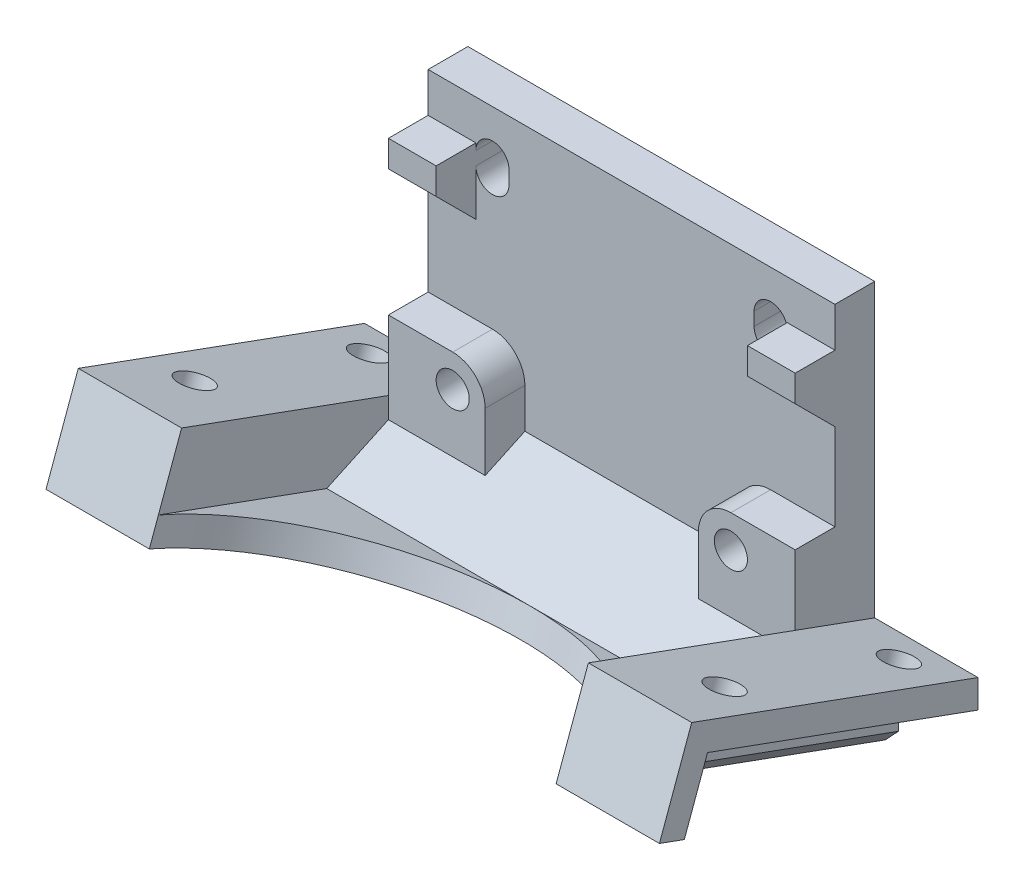
from build123d import *

# Parameters (mm, degrees)
BOSS_EXTRUDE1_DEPTH             = 3
BOSS_EXTRUDE2_REACH             = 67.424
BOSS_EXTRUDE2_DIRECTION_2_REACH = 67.424
BOSS_EXTRUDE3_DEPTH             = 1.8
BOSS_EXTRUDE4_DEPTH             = 6
SKETCH5_R                       = 1.2500000000000013
CUT_EXTRUDE1_DEPTH              = 52.534261642227
BOSS_EXTRUDE5_START             = -17.153882977
BOSS_EXTRUDE5_DEPTH             = 34.307765954
BOSS_EXTRUDE5_START_2           = -23.153882977
BOSS_EXTRUDE5_2_DEPTH           = 46.307765954
SKETCH7_R                       = 1.2499999999999996
CUT_EXTRUDE2_DEPTH              = 72.76321538065721
SKETCH8_R                       = 1.2499999999999996
SKETCH8_W                       = 3.603882977174097
SKETCH8_H                       = 2
BOSS_EXTRUDE6_DEPTH             = 3
CHAMFER1_SIZE                   = 3
CHAMFER3_SIZE                   = 1
CUT_EXTRUDE3_DEPTH              = 54.0045843552169


# Read off the part's stored shape, not the designer's step: Boss-Extrude5
with BuildPart() as part:
    # Sketch1 → Boss-Extrude1 (new body)
    with BuildSketch(Plane.XY):
        Polygon((15.353882977174102, 43.52586008583906), (-15.3538829771741, 43.52586008583904), (-15.3538829771741, 63.52586008583905), (15.3538829771741, 63.52586008583905), align=None)
    extrude(amount=BOSS_EXTRUDE1_DEPTH)

    # Boss-Extrude2: up to this face of the body (flat: up to its plane)
    boss_extrude2_end = Plane(part.part.faces().sort_by_distance((15.353882977, 53.525860086, 1.5))[0])
    # Sketch2 → Boss-Extrude2 (add, up to the picked face)
    with BuildSketch(Plane(origin=(0, 0, 0), x_dir=(0, 0, -1), z_dir=(1, 0, 0)), mode=Mode.PRIVATE) as boss_extrude2_sk1:
        Polygon((-3, 43.52586008583906), (0, 43.52586008583906), (0, 41.52586008583906), (-2.4353936802444784, 34.83467094188486), (-24.048323958320367, 42.701134238375246), (-23.36428367166903, 44.580519479947064), (-10.656874598929635, 39.95540082282564), align=None)
    boss_extrude2_tool1 = split(extrude(boss_extrude2_sk1.sketch, amount=BOSS_EXTRUDE2_REACH, mode=Mode.PRIVATE), bisect_by=boss_extrude2_end, keep=Keep.BOTH, mode=Mode.PRIVATE)
    add(boss_extrude2_tool1.solids().sort_by(Axis((0, 40.026068, 8.762362), (1, 0, 0)))[0])

    # Boss-Extrude2 direction 2: up to this face of the body (flat: up to its plane)
    boss_extrude2_direction_2_end = Plane(part.part.faces().sort_by_distance((-15.353882977, 53.525860086, 1.5))[0])
    # Sketch2 → Boss-Extrude2 direction 2 (add, up to the picked face)
    with BuildSketch(Plane(origin=(0, 0, 0), x_dir=(0, 0, -1), z_dir=(1, 0, 0)), mode=Mode.PRIVATE) as boss_extrude2_direction_2_sk1:
        Polygon((-3, 43.52586008583906), (0, 43.52586008583906), (0, 41.52586008583906), (-2.4353936802444784, 34.83467094188486), (-24.048323958320367, 42.701134238375246), (-23.36428367166903, 44.580519479947064), (-10.656874598929635, 39.95540082282564), align=None)
    boss_extrude2_direction_2_tool1 = split(extrude(boss_extrude2_direction_2_sk1.sketch, amount=-BOSS_EXTRUDE2_DIRECTION_2_REACH, mode=Mode.PRIVATE), bisect_by=boss_extrude2_direction_2_end, keep=Keep.BOTH, mode=Mode.PRIVATE)
    add(boss_extrude2_direction_2_tool1.solids().sort_by(Axis((0, 40.026068, 8.762362), (-1, 0, 0)))[0])

    # Sketch3 → Boss-Extrude3 (add)
    with BuildSketch(Plane(origin=(15.353882977174106, 1.33e-15, 0), x_dir=(0, 0, -1), z_dir=(1, 9e-17, 0))):
        Polygon((-24.048323958320367, 42.701134238375246), (-2.4353936802444798, 34.83467094188486), (3.04e-15, 41.52586008583906), (-21.61293027807589, 49.392323382329444), align=None)
    boss_extrude3 = extrude(amount=BOSS_EXTRUDE3_DEPTH)

    # Sketch4 → Boss-Extrude4 (add)
    with BuildSketch(Plane(origin=(17.1538829771741, 0, 0), x_dir=(0, 0, -1), z_dir=(1, 0, 0))):
        Polygon((-24.048323958320367, 42.701134238375246), (-21.61293027807589, 49.392323382329444), (2.6e-15, 41.52586008583906), (-0.6840402866513355, 39.64647484426724), (-20.41758532315541, 46.82889785410629), (-22.168938716748553, 42.01709395172391), align=None)
    boss_extrude4 = extrude(amount=BOSS_EXTRUDE4_DEPTH)

    # Mirror1: Boss-Extrude3, Boss-Extrude4 across plane
    add(boss_extrude3.mirror(Plane(origin=(0, 0, 0), x_dir=(0, 0, 1), z_dir=(1, 0, 0))))
    add(boss_extrude4.mirror(Plane(origin=(0, 0, 0), x_dir=(0, 0, 1), z_dir=(1, 0, 0))))

    # Sketch5 → Cut-Extrude1 (cut, through all)
    with BuildSketch(Plane(origin=(3.18e-15, 36.66825722516614, -13.34615417237709), x_dir=(1, -8e-17, 3e-17), z_dir=(0, 0.9396926207859083, -0.3420201433256693))):
        with Locations(Location((-20.000000000000004, -31.20268061828034, 0), (0, 0, 270))):
            Circle(SKETCH5_R)
        with Locations(Location((-20.000000000000004, -17.20268061828034, 0), (0, 0, 270))):
            Circle(SKETCH5_R)
        with Locations(Location((19.999999999999996, -17.202680618280336, 0), (0, 0, 270))):
            Circle(SKETCH5_R)
        with Locations(Location((19.999999999999996, -31.202680618280336, 0), (0, 0, 270))):
            Circle(SKETCH5_R)
    extrude(amount=-CUT_EXTRUDE1_DEPTH, mode=Mode.SUBTRACT)

    # Boss-Extrude5 outline → Boss-Extrude5 (add)
    with BuildSketch(Plane.YZ.offset(BOSS_EXTRUDE5_START)):
        Polygon((41.525860086, 0), (34.834670942, 2.43539368), (33.948260134, 0), align=None)
    extrude(amount=BOSS_EXTRUDE5_DEPTH)

    # Boss-Extrude5 2 outline → Boss-Extrude5 2 (add)
    with BuildSketch(Plane.YZ.offset(BOSS_EXTRUDE5_START_2)):
        Polygon((39.397504541, 0), (41.525860086, 0), (39.646474844, 0.684040287), align=None)
    extrude(amount=BOSS_EXTRUDE5_2_DEPTH)

    # Sketch7 → Cut-Extrude2 (cut, through all)
    with BuildSketch(Plane(origin=(0, 0, 0), x_dir=(-1, 0, 0), z_dir=(0, 0, -1))):
        with Locations((-10.500000000000007, 46.525860085839064)):
            Circle(SKETCH7_R)
        with Locations((10.499999999999993, 46.52586008583907)):
            Circle(SKETCH7_R)
        with BuildLine():
            Line((-11.750000000000007, 59.02586008583907), (-11.750000000000007, 60.02586008583906))
            ThreePointArc((-11.750000000000007, 60.02586008583906), (-10.500000000000009, 61.27586008583905), (-9.250000000000016, 60.02586008583906))
            Line((-9.250000000000016, 60.02586008583906), (-9.250000000000016, 59.02586008583907))
            ThreePointArc((-9.250000000000016, 59.02586008583907), (-10.500000000000009, 57.77586008583907), (-11.750000000000007, 59.02586008583907))
        make_face()
        with BuildLine():
            Line((9.249999999999991, 59.02586008583907), (9.249999999999991, 60.02586008583906))
            ThreePointArc((9.249999999999991, 60.02586008583906), (10.499999999999984, 61.27586008583906), (11.749999999999982, 60.02586008583906))
            Line((11.749999999999982, 60.02586008583906), (11.749999999999982, 59.02586008583907))
            ThreePointArc((11.749999999999982, 59.02586008583907), (10.499999999999995, 57.77586008583907), (9.249999999999991, 59.02586008583907))
        make_face()
    extrude(amount=-CUT_EXTRUDE2_DEPTH, mode=Mode.SUBTRACT)

    # Sketch8 → Boss-Extrude6 (add)
    # profile 1 of 2: a face of its own
    with BuildSketch(Plane.XY.offset(3)):
        with BuildLine():
            Line((15.353882977174102, 48.97586008583905), (10.500000000000007, 48.97586008583905))
            ThreePointArc((10.500000000000007, 48.97586008583905), (8.767588386092974, 48.258271699746096), (8.050000000000013, 46.525860085839064))
            Line((8.050000000000013, 46.525860085839064), (8.050000000000015, 40.525860085839064))
            Line((8.050000000000015, 40.525860085839064), (15.353882977174102, 40.525860085839064))
            Line((15.353882977174102, 40.525860085839064), (15.353882977174102, 48.97586008583905))
        make_face()
        with Locations(Location((10.500000000000007, 46.525860085839064, 0), (0, 0, 180))):
            Circle(SKETCH8_R, mode=Mode.SUBTRACT)
    # profile 2 of 2: a face of its own
    with BuildSketch(Plane.XY.offset(3)):
        with Locations((13.551941488587055, 59.52586008583907)):
            Rectangle(SKETCH8_W, SKETCH8_H)
    boss_extrude6 = extrude(amount=BOSS_EXTRUDE6_DEPTH)

    # Mirror2: Boss-Extrude6 across plane
    add(boss_extrude6.mirror(Plane(origin=(0, 0, 0), x_dir=(0, 0, 1), z_dir=(1, 0, 0))))

    # Chamfer1
    chamfer1_edges = [part.edges().sort_by_distance(p)[0] for p in [
        (13.551941488587055, 58.525860085839064, 3),
        (-13.551941488587055, 58.525860085839064, 3),
    ]]
    chamfer(chamfer1_edges, length=CHAMFER1_SIZE - 0.0001)  # a hair under: the kernel refuses the full size

    # Chamfer3
    chamfer3_edges = [part.edges().sort_by_distance(p)[0] for p in [
        (17.153882977174103, 38.42588244680438, 12.302166198496515),
        (-17.1538829771741, 38.42588244680438, 12.302166198496515),
    ]]
    chamfer(chamfer3_edges, length=CHAMFER3_SIZE)

    # Sketch9 → Cut-Extrude3 (cut, through all)
    with BuildSketch(Plane(origin=(0, 31.856453322783743, -11.59480077878396), x_dir=(1, 0, 0), z_dir=(0, 0.9396926207859083, -0.3420201433256693))):
        with BuildLine():
            Line((15.353882977174102, -37.20268061828036), (-15.3538829771741, -37.20268061828037))
            ThreePointArc((-15.3538829771741, -37.20268061828037), (-4.5e-16, -23.67973833731235), (15.353882977174102, -37.20268061828036))
        make_face()
    extrude(amount=-CUT_EXTRUDE3_DEPTH, mode=Mode.SUBTRACT)


solid = part.part
